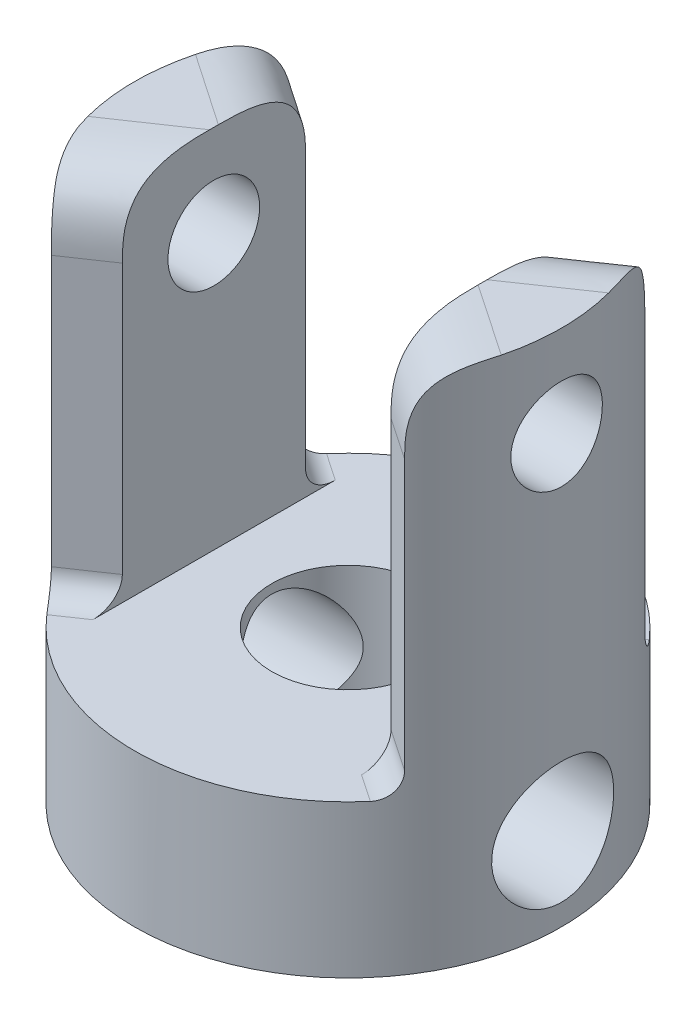
from build123d import *

# Parameters (mm, degrees)
SKETCH1_R               = 3.5
SKETCH1_R_2             = 1.25
BOSS_EXTRUDE1_DEPTH     = 2.5
BOSS_EXTRUDE2_DEPTH     = 6
FILLET5_SIZE            = 1.18
CUT_EXTRUDE1_DEPTH      = 10.836157944
CUT_EXTRUDE1_DEPTH_BACK = 10.836157944
SKETCH4_R               = 1
CUT_EXTRUDE2_DEPTH      = 10.836157949
CUT_EXTRUDE2_DEPTH_BACK = 10.836157949
SKETCH5_R               = 0.75
FILLET6_R               = 0.4


with BuildPart() as part:
    # Sketch1 → Boss-Extrude1 (new body)
    with BuildSketch(Plane(origin=(0, 0, 0), x_dir=(1, 0, 0), z_dir=(0, 1, 0))):
        with Locations(Location((0, 0, 0), (0, 0, 270))):
            Circle(SKETCH1_R)
        with Locations(Location((0, 0, 0), (0, 0, 270))):
            Circle(SKETCH1_R_2, mode=Mode.SUBTRACT)
    extrude(amount=BOSS_EXTRUDE1_DEPTH)

    # Sketch2 → Boss-Extrude2 (add)
    with BuildSketch(Plane(origin=(0, 2.5, 0), x_dir=(1, 0, 0), z_dir=(0, 1, 0))):
        with BuildLine():
            Line((-2.894764476, -1.967317623), (-2.202258565, -1.496682069))
            Line((-2.202258565, -1.496682069), (-2.197736437, 1.503314523))
            Line((-2.197736437, 1.503314523), (-2.888820353, 1.97603567))
            ThreePointArc((-2.888820353, 1.97603567), (-3.499996024, 0.005275816), (-2.894764476, -1.967317623))
        make_face()
        with BuildLine():
            ThreePointArc((2.894764476, -1.967317623), (3.499996024, 0.005275816), (2.888820353, 1.97603567))
            Line((2.888820353, 1.97603567), (2.202258565, 1.506407788))
            Line((2.202258565, 1.506407788), (2.202258565, -1.496682069))
            Line((2.202258565, -1.496682069), (2.894764476, -1.967317623))
        make_face()
    extrude(amount=BOSS_EXTRUDE2_DEPTH)

    # Fillet5
    # a fillet whose section is not a circle: 1.18 mm, written as the material it takes off along each edge
    with BuildSketch(Plane(origin=(-5.334637391, 8.5, 3.625485334), x_dir=(0, -1, 0), z_dir=(0.8270755645354999, 0, -0.562090749388641)), Plane(origin=(-0.237614351, 8.5, -0.161485642), x_dir=(0, -1, 0), z_dir=(0.8270755645354999, 0, 0.562090749388641)), Plane(origin=(0.237126432, 8.5, 0.162201256), x_dir=(0, -1, 0), z_dir=(-0.8253772437393475, 0, -0.5645816198896648))) as fillet5_piece_1:
        with BuildLine():
            add(Edge.make_bspline([(FILLET5_SIZE, 0), (FILLET5_SIZE * 0.831801948466, 0), (FILLET5_SIZE * 0.663603896932, 0), (FILLET5_SIZE * 0.292893218813, FILLET5_SIZE * 0.0716919198361), (FILLET5_SIZE * 0.0716919198361, FILLET5_SIZE * 0.292893218813), (0, FILLET5_SIZE * 0.663603896932), (0, FILLET5_SIZE * 0.831801948466), (0, FILLET5_SIZE)], knots=[0, 0, 0, 0, 0, 0, 0.5, 0.5, 1, 1, 1, 1, 1, 1], degree=5))
            Line((0, FILLET5_SIZE), (0, 0))
            Line((0, 0), (FILLET5_SIZE, 0))
        make_face()
    extrude(amount=6.737294609, mode=Mode.SUBTRACT)
    with BuildSketch(Plane(origin=(5.323683222, 8.5, -3.641551448), x_dir=(0, -1, 0), z_dir=(-0.8253772437393473, 0, 0.564581619889665))) as fillet5_piece_2:
        with BuildLine():
            add(Edge.make_bspline([(FILLET5_SIZE, 0), (FILLET5_SIZE * 0.831801948466, 0), (FILLET5_SIZE * 0.663603896932, 0), (FILLET5_SIZE * 0.292893218813, FILLET5_SIZE * 0.0716919198361), (FILLET5_SIZE * 0.0716919198361, FILLET5_SIZE * 0.292893218813), (0, FILLET5_SIZE * 0.663603896932), (0, FILLET5_SIZE * 0.831801948466), (0, FILLET5_SIZE)], knots=[0, 0, 0, 0, 0, 0, 0.5, 0.5, 1, 1, 1, 1, 1, 1], degree=5))
            Line((0, FILLET5_SIZE), (0, 0))
            Line((0, 0), (FILLET5_SIZE, 0))
        make_face()
    extrude(amount=6.731815747, mode=Mode.SUBTRACT)

    # Sketch4 → Cut-Extrude1 (cut, two sides: drawn at the far end of the back side and taken through both)
    with BuildSketch(Plane(origin=(0, 0, 0), x_dir=(0, 0, -1), z_dir=(1, 0, 0)).offset(-CUT_EXTRUDE1_DEPTH_BACK)):
        with Locations((0, 1.35)):
            Circle(SKETCH4_R)
    extrude(amount=CUT_EXTRUDE1_DEPTH + CUT_EXTRUDE1_DEPTH_BACK, mode=Mode.SUBTRACT)

    # Sketch5 → Cut-Extrude2 (cut, two sides: drawn at the far end of the back side and taken through both)
    with BuildSketch(Plane(origin=(0, 0, 0), x_dir=(0, 0, -1), z_dir=(1, 0, 0)).offset(-CUT_EXTRUDE2_DEPTH_BACK)):
        with Locations((0, 7)):
            Circle(SKETCH5_R)
    extrude(amount=CUT_EXTRUDE2_DEPTH + CUT_EXTRUDE2_DEPTH_BACK, mode=Mode.SUBTRACT)

    # Fillet6
    # the kernel refuses this fillet: 0.4 mm, written as the material it adds along each edge
    with BuildSketch(Plane(origin=(-1.372359193, 2.5, -0.938732903), x_dir=(0.5645816198896647, 0, -0.8253772437393474), z_dir=(-0.8253772437393475, 0, -0.5645816198896648))) as fillet6_piece_1_section:
        with BuildLine():
            CenterArc((FILLET6_R, -FILLET6_R), FILLET6_R, 90, 90)
            Line((0, -FILLET6_R), (0, 0))
            Line((0, 0), (FILLET6_R, 0))
        make_face()
    fillet6_piece_1 = extrude(amount=2.837294609, mode=Mode.PRIVATE)
    fillet6_piece_1 = fillet6_piece_1 & Plane(origin=(0, 2.5, 0), x_dir=(0, 0, 1), z_dir=(0, -1, 0)) * Cylinder(3.5, 8, mode=Mode.PRIVATE)
    fillet6_piece_1 = split(fillet6_piece_1, bisect_by=Plane(origin=(-2.198585597, 2.5, -0.939978338), z_dir=(-0.9999988639081823, 0, -0.00150737597993326)), keep=Keep.TOP, mode=Mode.PRIVATE)
    with BuildSketch(Plane(origin=(-3.72184004, 2.5, 2.529408372), x_dir=(0.562090749388641, 0, 0.8270755645354999), z_dir=(0.8270755645354999, 0, -0.562090749388641))) as fillet6_piece_2_section:
        with BuildLine():
            CenterArc((FILLET6_R, -FILLET6_R), FILLET6_R, 90, 90)
            Line((0, -FILLET6_R), (0, 0))
            Line((0, 0), (FILLET6_R, 0))
        make_face()
    fillet6_piece_2 = extrude(amount=2.837294609, mode=Mode.PRIVATE)
    fillet6_piece_2 = fillet6_piece_2 & Plane(origin=(0, 2.5, 0), x_dir=(0, 0, 1), z_dir=(0, -1, 0)) * Cylinder(3.5, 8, mode=Mode.PRIVATE)
    fillet6_piece_2 = split(fillet6_piece_2, bisect_by=Plane(origin=(-2.203818722, 2.5, 2.531696604), z_dir=(-0.9999988639081823, 0, -0.00150737597993326)), keep=Keep.TOP, mode=Mode.PRIVATE)
    with BuildSketch(Plane(origin=(1.375183, 2.5, 0.934591319), x_dir=(-0.562090749388641, 0, 0.8270755645354999), z_dir=(0.8270755645354999, 0, 0.562090749388641))) as fillet6_piece_3_section:
        with BuildLine():
            CenterArc((FILLET6_R, -FILLET6_R), FILLET6_R, 90, 90)
            Line((0, -FILLET6_R), (0, 0))
            Line((0, 0), (FILLET6_R, 0))
        make_face()
    fillet6_piece_3 = extrude(amount=2.837294609, mode=Mode.PRIVATE)
    fillet6_piece_3 = fillet6_piece_3 & Plane(origin=(0, 2.5, 0), x_dir=(0, 0, 1), z_dir=(0, -1, 0)) * Cylinder(3.5, 8, mode=Mode.PRIVATE)
    fillet6_piece_3 = split(fillet6_piece_3, bisect_by=Plane(origin=(2.202258565, 2.5, 0.934591319), z_dir=(1, 0, 0)), keep=Keep.TOP, mode=Mode.PRIVATE)
    with BuildSketch(Plane(origin=(3.714197597, 2.5, -2.54061729), x_dir=(-0.5645816198896649, 0, -0.8253772437393473), z_dir=(-0.8253772437393473, 0, 0.564581619889665))) as fillet6_piece_4_section:
        with BuildLine():
            CenterArc((FILLET6_R, -FILLET6_R), FILLET6_R, 90, 90)
            Line((0, -FILLET6_R), (0, 0))
            Line((0, 0), (FILLET6_R, 0))
        make_face()
    fillet6_piece_4 = extrude(amount=2.831815747, mode=Mode.PRIVATE)
    fillet6_piece_4 = fillet6_piece_4 & Plane(origin=(0, 2.5, 0), x_dir=(0, 0, 1), z_dir=(0, -1, 0)) * Cylinder(3.5, 8, mode=Mode.PRIVATE)
    fillet6_piece_4 = split(fillet6_piece_4, bisect_by=Plane(origin=(2.202258565, 2.5, -2.54061729), z_dir=(1, 0, 0)), keep=Keep.TOP, mode=Mode.PRIVATE)
    add([fillet6_piece_1, fillet6_piece_2, fillet6_piece_3, fillet6_piece_4])


solid = part.part
